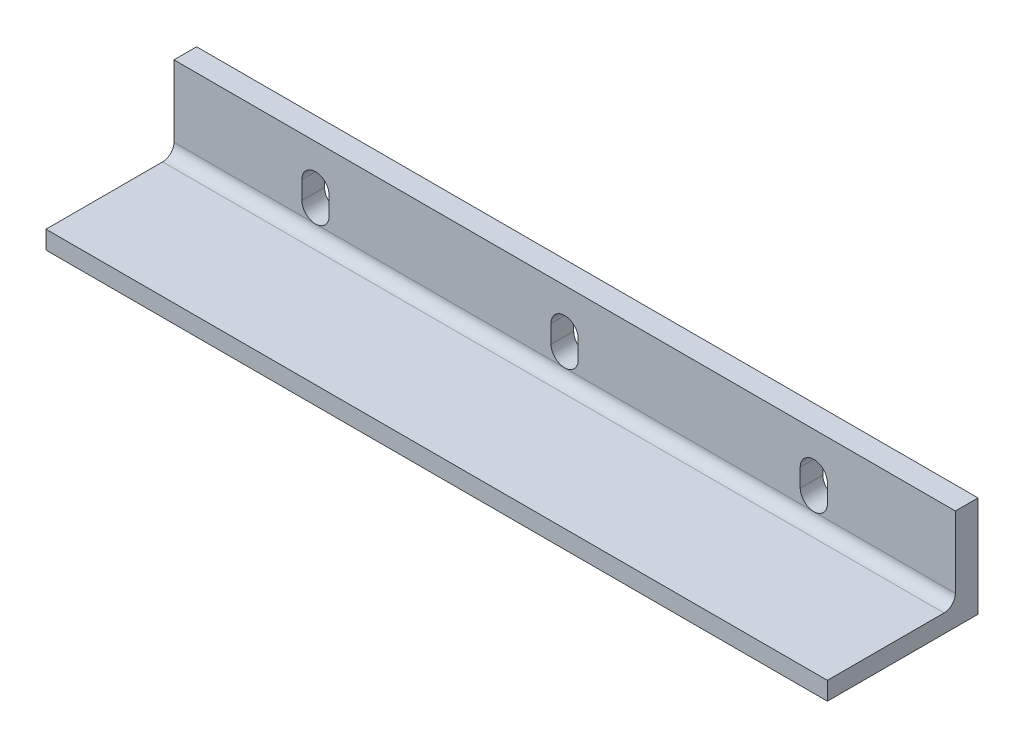
from build123d import *

# Parameters (mm, degrees)
SKETCH1_W                = 69
SKETCH1_H                = 13.3
BOSS_EXTRUDE1_DEPTH      = 1.6
SKETCH2_W                = 69
SKETCH2_H                = 2
BOSS_EXTRUDE2_DEPTH      = 7.3
FILLET1_R                = 1
M2_START                 = -6.65
M2_CLEARANCE_SLOT1_DEPTH = 2


# Read off the part's stored shape, not the designer's step: M2 Clearance Slot1
with BuildPart() as part:
    # Sketch1 → Boss-Extrude1 (new body)
    with BuildSketch(Plane(origin=(0, 0, 0), x_dir=(1, 0, 0), z_dir=(0, 1, 0))):
        Rectangle(SKETCH1_W, SKETCH1_H)
    extrude(amount=BOSS_EXTRUDE1_DEPTH)

    # Sketch2 → Boss-Extrude2 (add)
    with BuildSketch(Plane(origin=(0, 1.6, 0), x_dir=(1, 0, 0), z_dir=(0, 1, 0))):
        with Locations((0, 5.65)):
            Rectangle(SKETCH2_W, SKETCH2_H)
    extrude(amount=BOSS_EXTRUDE2_DEPTH)

    # Fillet1
    fillet1_edges = [part.edges().sort_by_distance(p)[0] for p in [
        (0, 1.6, -4.65),
    ]]
    fillet(fillet1_edges, radius=FILLET1_R)

    # M2 Clearance Slot1 outline → M2 Clearance Slot1 (cut)
    with BuildSketch(Plane.XY.offset(M2_START)):
        with BuildLine():
            Line((23.2, 3.8), (23.2, 5.4))
            ThreePointArc((23.2, 5.4), (22, 6.6), (20.8, 5.4))
            Line((20.8, 5.4), (20.8, 3.8))
            ThreePointArc((20.8, 3.8), (22, 2.6), (23.2, 3.8))
        make_face()
        with BuildLine():
            Line((1.2, 3.8), (1.2, 5.4))
            ThreePointArc((1.2, 5.4), (0, 6.6), (-1.2, 5.4))
            Line((-1.2, 5.4), (-1.2, 3.8))
            ThreePointArc((-1.2, 3.8), (0, 2.6), (1.2, 3.8))
        make_face()
        with BuildLine():
            Line((-20.8, 3.8), (-20.8, 5.4))
            ThreePointArc((-20.8, 5.4), (-22, 6.6), (-23.2, 5.4))
            Line((-23.2, 5.4), (-23.2, 3.8))
            ThreePointArc((-23.2, 3.8), (-22, 2.6), (-20.8, 3.8))
        make_face()
    extrude(amount=M2_CLEARANCE_SLOT1_DEPTH, mode=Mode.SUBTRACT)


solid = part.part
